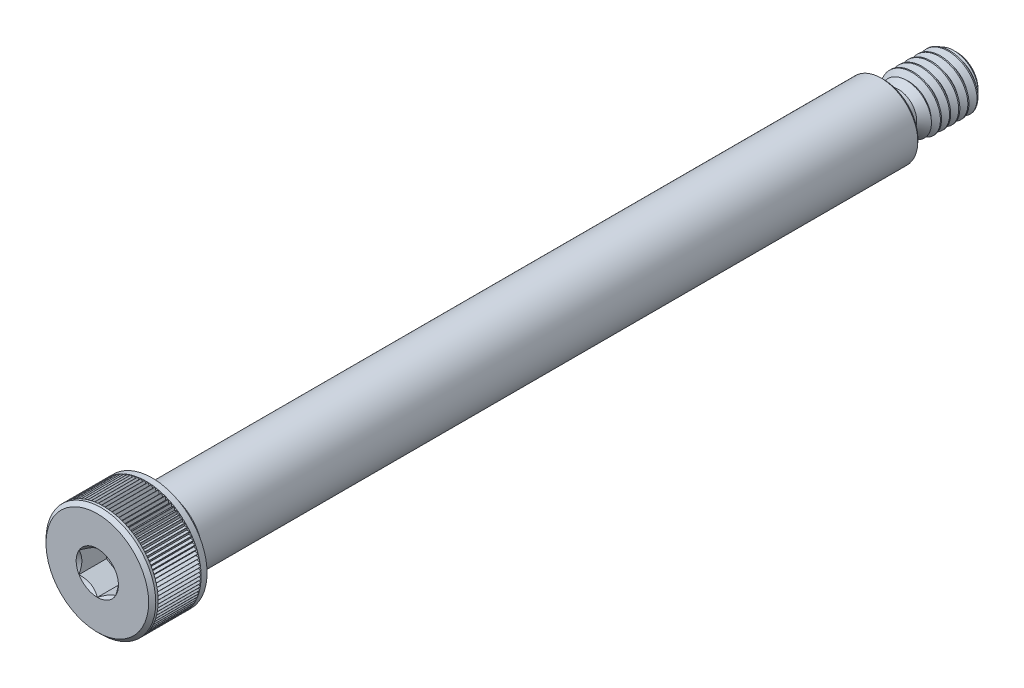
from build123d import *

# Parameters (mm, degrees)
SKETCH12_R          = 2.413
BOSS_EXTRUDE1_DEPTH = 6.35
CHAMFER1_SIZE       = 0.60325
CHAMFER2_SIZE       = 0.3095625
FILLET1_R           = 0.1984375
CUT_EXTRUDE2_DEPTH  = 2.38125
CUT_SWEEP1_PITCH    = 0.79375
SKETCH14_R          = 1.2065
BOSS_EXTRUDE2_DEPTH = 5.159375
CUT_EXTRUDE5_DEPTH  = 1.86451875
CIRPATTERN1_COUNT   = 99


with BuildPart() as part:
    # Sketch13 → Revolve1 (revolve)
    with BuildSketch(Plane(origin=(0, 0, 0), x_dir=(0, 0, -1), z_dir=(1, 0, 0)), mode=Mode.PRIVATE) as revolve1_sk:
        Polygon((0, 0), (0, 4.7625), (4.7625, 4.7625), (4.7625, 2.936875), (5.715, 2.936875), (5.953125, 3.175), (68.024375, 3.175), (68.2625, 2.936875), (68.2625, 0), align=None)
    revolve(revolve1_sk.sketch.rotate(Axis((0, 0, -68.2625), (0, 0, 1)), 90), axis=Axis((0, 0, -68.2625), (0, 0, 1)))

    # Sketch12 → Boss-Extrude1 (add)
    with BuildSketch(Plane(origin=(0, 0, -68.2625), x_dir=(-1, 0, 0), z_dir=(0, 0, -1))):
        Circle(SKETCH12_R)
    extrude(amount=BOSS_EXTRUDE1_DEPTH)

    # Sketch5 → Cut-Revolve1 (revolve, cut)
    with BuildSketch(Plane(origin=(0, 0, 0), x_dir=(0, 0, -1), z_dir=(1, 0, 0))):
        Polygon((68.2625, 2.413), (70.37705, 2.413), (69.5325, 1.56845), (68.2625, 1.56845), align=None)
    revolve(axis=Axis((0, 0, -68.2625), (0, 0, 1)), mode=Mode.SUBTRACT)

    # Chamfer1
    chamfer1_edges = [part.edges().sort_by_distance(p)[0] for p in [
        (2.413, 0, -74.6125),
    ]]
    chamfer(chamfer1_edges, length=CHAMFER1_SIZE)

    # Chamfer2
    chamfer2_edges = [part.edges().sort_by_distance(p)[0] for p in [
        (4.7625, 0, 0),
    ]]
    chamfer(chamfer2_edges, length=CHAMFER2_SIZE)

    # Fillet1
    fillet1_edges = [part.edges().sort_by_distance(p)[0] for p in [
        (0, -1.56845, -68.2625),
    ]]
    fillet(fillet1_edges, radius=FILLET1_R)

    # Sketch8 → Cut-Extrude2 (cut)
    with BuildSketch(Plane.XY):
        Polygon((1.5875, 0.916543552), (0, 1.833087105), (-1.5875, 0.916543552), (-1.5875, -0.916543552), (0, -1.833087105), (1.5875, -0.916543552), align=None)
    extrude(amount=-CUT_EXTRUDE2_DEPTH, mode=Mode.SUBTRACT)

    # Cut-Extrude4 cone 1 section (through the dimple's axis) → Cut-Extrude4 (revolve, cut)
    with BuildSketch(Plane(origin=(0, 0, 0), x_dir=(0, -1, 0), z_dir=(1, 0, 0))):
        Polygon((0, 0), (1.833087105, 0), (0, 1.833087105), align=None)
    revolve(axis=Axis((0, 0, 0), (0, 0, -1)), mode=Mode.SUBTRACT)


with BuildPart() as body_2:
    # Split1: the piece on the far side of the plane
    add(part.part)
    split(bisect_by=Plane.XY.offset(-68.2625), keep=Keep.BOTTOM)

    # Cut-Sweep1: the profile of Sketch4 screwed along a right-hand helix of 7 turns, 8 arcs to a turn; built about Z, then put on its axis
    cut_sweep1_z = Axis((0, 0, 0), (0, 0, 1))
    cut_sweep1_corners = [(1.897444252, 0, -0.29765625), (1.897444252, 0, -0.396875), (2.455962979, 0, -0.719335937), (2.455962979, 0, -0.347265625), (2.455962979, 0, 0.024804688)]
    with BuildLine(mode=Mode.PRIVATE) as cut_sweep1_profile:
        Line(cut_sweep1_corners[0], cut_sweep1_corners[1])
        Line(cut_sweep1_corners[1], cut_sweep1_corners[2])
        Line(cut_sweep1_corners[2], cut_sweep1_corners[3])
        Line(cut_sweep1_corners[3], cut_sweep1_corners[4])
        Line(cut_sweep1_corners[4], cut_sweep1_corners[0])
    cut_sweep1_cap = Face(cut_sweep1_profile.wire())
    cut_sweep1_turn_angles = [0, 22.5, 45, 67.5, 90, 112.5, 135, 157.5, 180, 202.5, 225, 247.5, 270, 292.5, 315, 337.5, 360]
    cut_sweep1_turn_weights = [1, 0.9238795325112867, 1, 0.9238795325112867, 1, 0.9238795325112867, 1, 0.9238795325112867, 1, 0.9238795325112867, 1, 0.9238795325112867, 1, 0.9238795325112867, 1, 0.9238795325112867, 1]
    cut_sweep1_turn_rails = [Edge.make_bspline([Vector(p[0], p[1], 0).rotate(cut_sweep1_z, cut_sweep1_turn_angles[k]) / cut_sweep1_turn_weights[k] + Vector(0, 0, p[2] + CUT_SWEEP1_PITCH * cut_sweep1_turn_angles[k] / 360) for k in range(17)], [0, 0, 0, 1, 1, 2, 2, 3, 3, 4, 4, 5, 5, 6, 6, 7, 7, 8, 8, 8], 2, cut_sweep1_turn_weights) for p in cut_sweep1_corners]
    cut_sweep1_turn_sides = [Face.make_surface_from_curves(cut_sweep1_turn_rails[p[0]], cut_sweep1_turn_rails[p[1]]) for p in [(0, 1), (1, 2), (2, 3), (3, 4), (4, 0)]]
    cut_sweep1 = Plane(origin=(0, 0, -74.6125), x_dir=(0, 1, 0), z_dir=(0, 0, 1)) * Solid(Shell([*[p.moved(Location((0, 0, CUT_SWEEP1_PITCH * i))) for i in range(7) for p in cut_sweep1_turn_sides], cut_sweep1_cap, cut_sweep1_cap.rotate(cut_sweep1_z, 2520).moved(Location((0, 0, CUT_SWEEP1_PITCH * 2520 / 360)))]))
    add(cut_sweep1, mode=Mode.SUBTRACT)


with BuildPart() as part_1:
    add(part.part)

    # Split1
    split(bisect_by=Plane.XY.offset(-68.2625), keep=Keep.TOP)

    add(body_2.part)  # Boss-Extrude2 merges body 2
    # Sketch14 → Boss-Extrude2 (add)
    with BuildSketch(Plane(origin=(0, 0, -68.2625), x_dir=(-1, 0, 0), z_dir=(0, 0, -1))):
        Circle(SKETCH14_R)
    extrude(amount=BOSS_EXTRUDE2_DEPTH)

    # Sketch11 → Cut-Extrude5 (cut, symmetric)
    with BuildSketch(Plane.XY.offset(-2.38125)):
        Polygon((0, 4.51485), (0.142980794, 4.7625), (-0.142980794, 4.7625), align=None)
    cut_extrude5 = extrude(amount=CUT_EXTRUDE5_DEPTH, both=True, mode=Mode.SUBTRACT)

    # CirPattern1: Cut-Extrude5 ×99 about axis
    cirpattern1_axis = Axis((0, 0, 0), (0, 0, 1))
    for i in range(1, CIRPATTERN1_COUNT):
        add(cut_extrude5.rotate(cirpattern1_axis, i * 360 / CIRPATTERN1_COUNT), mode=Mode.SUBTRACT)


solid = part_1.part
